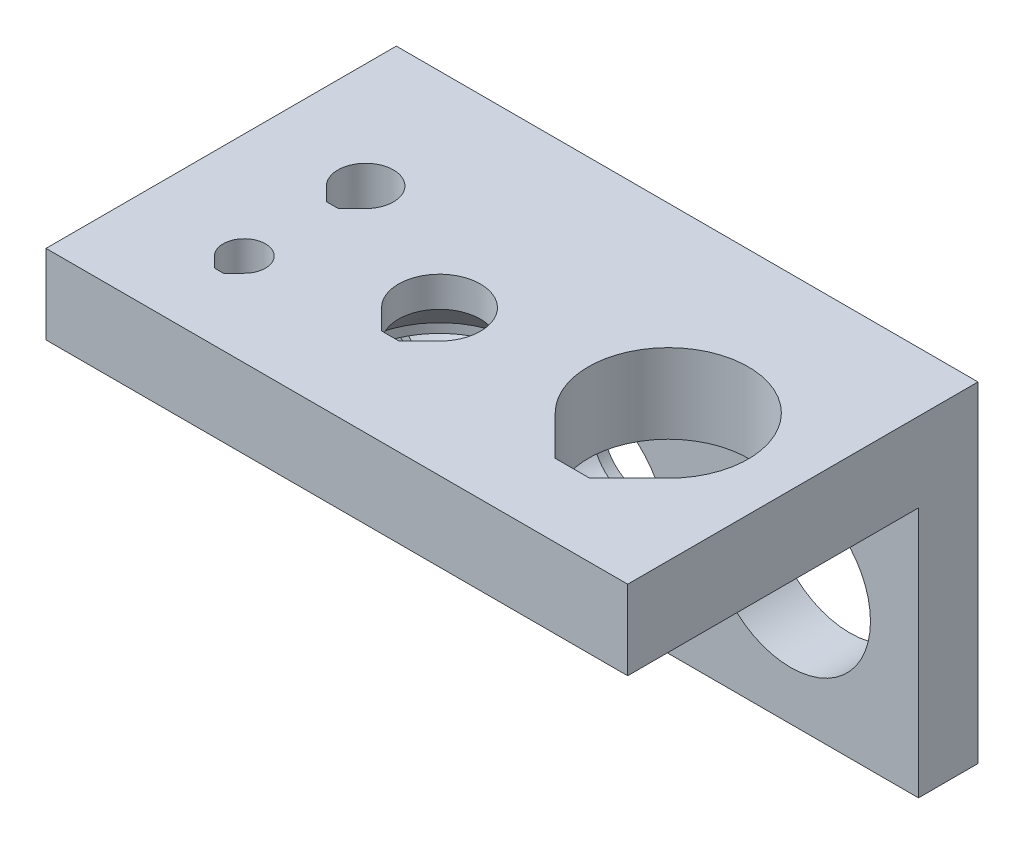
from build123d import *

# Parameters (mm, degrees)
SKETCH1_W                = 44
SKETCH1_H                = 25
BOSS_EXTRUDE1_DEPTH      = 4.5
SKETCH2_W                = 44
SKETCH2_H                = 6
BOSS_EXTRUDE2_DEPTH      = 22
SKETCH3_R                = 1.6
SKETCH3_R_2              = 2.1
SKETCH3_R_3              = 3.1
SKETCH3_R_4              = 6.05
CUT_EXTRUDE1_DEPTH       = 34.529837459
SKETCH4_R                = 6.1
CUT_EXTRUDE2_DEPTH       = 0.7
SKETCH5_R                = 4.1
CUT_EXTRUDE3_DEPTH       = 0.5
SKETCH6_R                = 3.1
CUT_EXTRUDE4_DEPTH       = 0.4
CHAMFER4_SIZE            = 3
CHAMFER5_SIZE            = 2
CHAMFER6_SIZE            = 1.5
CHAMFER4_OF_MIRROR1_SIZE = 3
CHAMFER5_OF_MIRROR1_SIZE = 2
CHAMFER6_OF_MIRROR1_SIZE = 1.5
CUT_EXTRUDE5_DEPTH       = 43.558782877


with BuildPart() as part:
    # Sketch1 → Boss-Extrude1 (new body)
    with BuildSketch(Plane.XY):
        Rectangle(SKETCH1_W, SKETCH1_H)
    extrude(amount=BOSS_EXTRUDE1_DEPTH)

    # Sketch2 → Boss-Extrude2 (add)
    with BuildSketch(Plane.XY.offset(4.5)):
        with Locations((0, 9.5)):
            Rectangle(SKETCH2_W, SKETCH2_H)
    extrude(amount=BOSS_EXTRUDE2_DEPTH)

    # Sketch3 → Cut-Extrude1 (cut, through all)
    with BuildSketch(Plane.XY.offset(4.5)):
        with Locations((-14, -8.5)):
            Circle(SKETCH3_R)
        with Locations((-14, 0.682507664)):
            Circle(SKETCH3_R_2)
        with Locations((-3.234639789, -4.5)):
            Circle(SKETCH3_R_3)
        with Locations((12.315992983, -2.743651106)):
            Circle(SKETCH3_R_4)
    cut_extrude1 = extrude(amount=-CUT_EXTRUDE1_DEPTH, mode=Mode.SUBTRACT)

    # Sketch4 → Cut-Extrude2 (cut)
    with BuildSketch(Plane.XY.offset(4.5)):
        with Locations((-3.234639789, -4.5)):
            Circle(SKETCH4_R)
    cut_extrude2 = extrude(amount=-CUT_EXTRUDE2_DEPTH, mode=Mode.SUBTRACT)

    # Sketch5 → Cut-Extrude3 (cut)
    with BuildSketch(Plane.XY.offset(4.5)):
        with Locations((-14, 0.682507664)):
            Circle(SKETCH5_R)
    cut_extrude3 = extrude(amount=-CUT_EXTRUDE3_DEPTH, mode=Mode.SUBTRACT)

    # Sketch6 → Cut-Extrude4 (cut)
    with BuildSketch(Plane.XY.offset(4.5)):
        with Locations((-14, -8.5)):
            Circle(SKETCH6_R)
    cut_extrude4 = extrude(amount=-CUT_EXTRUDE4_DEPTH, mode=Mode.SUBTRACT)

    # Chamfer4
    chamfer4_edges = [part.edges().sort_by_distance(p)[0] for p in [
        (-6.334639789, -4.5, 3.8),
    ]]
    chamfer(chamfer4_edges, length=CHAMFER4_SIZE - 0.0001)  # a hair under: the kernel refuses the full size

    # Chamfer5
    chamfer5_edges = [part.edges().sort_by_distance(p)[0] for p in [
        (-16.1, 0.682507664, 4),
    ]]
    chamfer(chamfer5_edges, length=CHAMFER5_SIZE - 0.0001)  # a hair under: the kernel refuses the full size

    # Chamfer6
    chamfer6_edges = [part.edges().sort_by_distance(p)[0] for p in [
        (-15.6, -8.5, 4.1),
    ]]
    chamfer(chamfer6_edges, length=CHAMFER6_SIZE - 0.0001)  # a hair under: the kernel refuses the full size

    # Mirror1: Cut-Extrude1, Cut-Extrude2, Cut-Extrude3, Cut-Extrude4 across plane
    add(cut_extrude1.mirror(Plane(origin=(0, 5.5, 5.5), x_dir=(0, -0.7071067811865512, 0.7071067811865439), z_dir=(0, -0.7071067811865438, -0.7071067811865512))), mode=Mode.SUBTRACT)
    add(cut_extrude2.mirror(Plane(origin=(0, 5.5, 5.5), x_dir=(0, -0.7071067811865512, 0.7071067811865439), z_dir=(0, -0.7071067811865438, -0.7071067811865512))), mode=Mode.SUBTRACT)
    add(cut_extrude3.mirror(Plane(origin=(0, 5.5, 5.5), x_dir=(0, -0.7071067811865512, 0.7071067811865439), z_dir=(0, -0.7071067811865438, -0.7071067811865512))), mode=Mode.SUBTRACT)
    add(cut_extrude4.mirror(Plane(origin=(0, 5.5, 5.5), x_dir=(0, -0.7071067811865512, 0.7071067811865439), z_dir=(0, -0.7071067811865438, -0.7071067811865512))), mode=Mode.SUBTRACT)

    # Chamfer4 of Mirror1
    chamfer4_of_mirror1_edges = [part.edges().sort_by_distance(p)[0] for p in [
        (-6.334639789, 7.2, 15.5),
    ]]
    chamfer(chamfer4_of_mirror1_edges, length=CHAMFER4_OF_MIRROR1_SIZE - 0.0001)  # a hair under: the kernel refuses the full size

    # Chamfer5 of Mirror1
    chamfer5_of_mirror1_edges = [part.edges().sort_by_distance(p)[0] for p in [
        (-16.1, 7, 10.317492336),
    ]]
    chamfer(chamfer5_of_mirror1_edges, length=CHAMFER5_OF_MIRROR1_SIZE - 0.0001)  # a hair under: the kernel refuses the full size

    # Chamfer6 of Mirror1
    chamfer6_of_mirror1_edges = [part.edges().sort_by_distance(p)[0] for p in [
        (-15.6, 6.9, 19.5),
    ]]
    chamfer(chamfer6_of_mirror1_edges, length=CHAMFER6_OF_MIRROR1_SIZE - 0.0001)  # a hair under: the kernel refuses the full size

    # Sketch7 → Cut-Extrude5 (cut, through all)
    with BuildSketch(Plane(origin=(0, 12.5, 0), x_dir=(1, 0, 0), z_dir=(0, 1, 0))):
        Polygon((-14.3427417, -21.42), (-13.6572583, -21.42), (-12.86862915, -20.63137085), (-14, -19.5), (-15.13137085, -20.63137085), align=None)
        Polygon((-3.234639789, -15.5), (-1.042608767, -17.692031022), (-2.570577745, -19.22), (-3.898701832, -19.22), (-5.42667081, -17.692031022), align=None)
        Polygon((12.315992983, -13.743651106), (16.593989009, -18.021647132), (13.621985035, -20.993651106), (11.010000931, -20.993651106), (8.037996957, -18.021647132), align=None)
        Polygon((-14, -10.317492336), (-12.51507576, -11.802416576), (-13.550151519, -12.837492336), (-14.449848481, -12.837492336), (-15.48492424, -11.802416576), align=None)
    extrude(amount=-CUT_EXTRUDE5_DEPTH, mode=Mode.SUBTRACT)


solid = part.part
